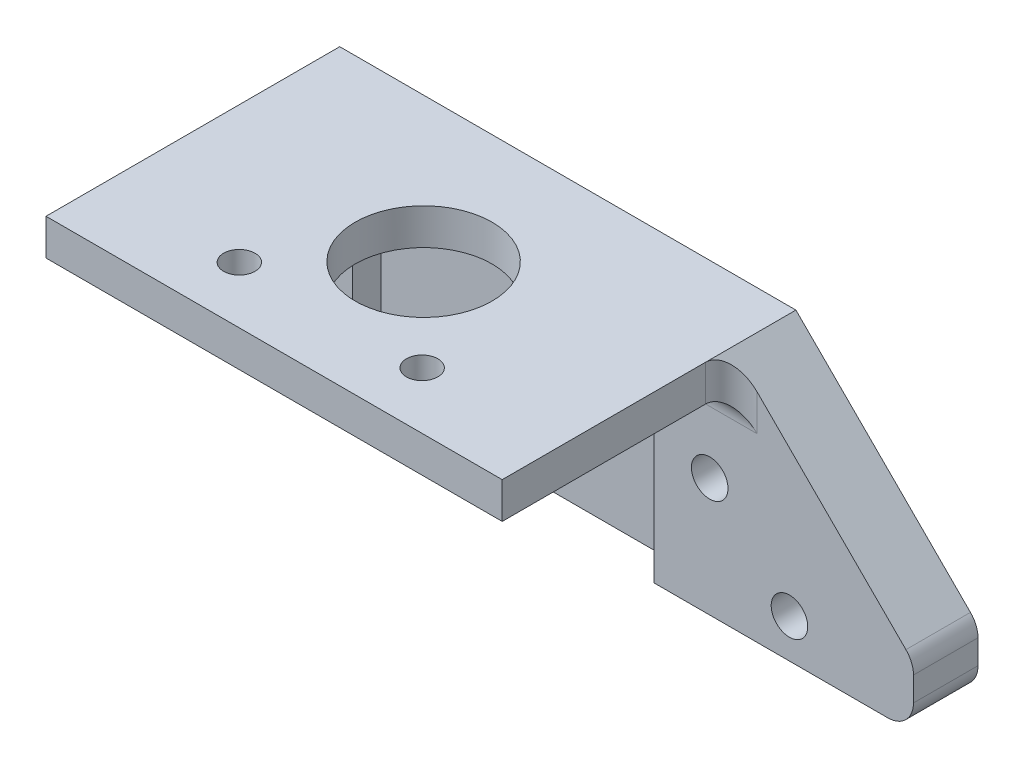
from build123d import *

# Parameters (mm, degrees)
BOSS_EXTRUDE1_DEPTH      = 1.7859375
BOSS_EXTRUDE1_DEPTH_BACK = 1.7859375
SKETCH2_W                = 45
SKETCH2_H                = 3.571875
BOSS_EXTRUDE2_DEPTH      = 25.4
FILLET1_R                = 2
SKETCH9_W                = 44.9012818
SKETCH9_H                = 1.417156311
CUT_EXTRUDE1_DEPTH       = 10
BOSS_EXTRUDE3_DEPTH      = 3.571875
SKETCH14_R               = 2.4384
CUT_EXTRUDE4_DEPTH       = 53.928506192
CUT_EXTRUDE5_DEPTH       = 57.499569383
CUT_EXTRUDE5_DEPTH_BACK  = 57.499569383
SKETCH15_R               = 6.75
SKETCH15_R_2             = 1.55
SKETCH19_R               = 1.8034
BOSS_EXTRUDE6_DEPTH      = 2.794
FILLET3_R                = 2.54


with BuildPart() as part:
    # Sketch1 → Boss-Extrude1 (new, two sides: drawn at the far end of the back side and taken through both)
    with BuildSketch(Plane.XY.offset(5).offset(-BOSS_EXTRUDE1_DEPTH_BACK)):
        with BuildLine():
            Line((-21.183407813, 0), (-21.183407813, -8.813455393))
            ThreePointArc((-21.183407813, -8.813455393), (-22.866221682, -12.686440931), (-19.530849883, -15.276262248))
            Line((-19.530849883, -15.276262248), (24.68248716, -15.276262248))
            ThreePointArc((24.68248716, -15.276262248), (25.214329472, -14.744419936), (24.68248716, -14.212577623))
            Line((24.68248716, -14.212577623), (23.717873987, 0))
            Line((23.717873987, 0), (23.717873987, 4.989031311))
            Line((23.717873987, 4.989031311), (-21.183407813, 4.989031311))
            Line((-21.183407813, 4.989031311), (-21.183407813, 0))
        make_face()
    extrude(amount=BOSS_EXTRUDE1_DEPTH + BOSS_EXTRUDE1_DEPTH_BACK)

    # Sketch2 → Boss-Extrude2 (add)
    with BuildSketch(Plane.XY.offset(6.7859375)):
        with Locations((1.270019176, 1.7859375)):
            Rectangle(SKETCH2_W, SKETCH2_H)
    extrude(amount=BOSS_EXTRUDE2_DEPTH)

    # Fillet1
    fillet1_edges = [part.edges().sort_by_distance(p)[0] for p in [
        (1.267233087, 4.989031311, 3.2140625),
    ]]
    fillet(fillet1_edges, radius=FILLET1_R)

    # Sketch9 → Cut-Extrude1 (cut)
    with BuildSketch(Plane.XY.offset(6.7859375)):
        with Locations((1.267233087, 4.280453156)):
            Rectangle(SKETCH9_W, SKETCH9_H)
    extrude(amount=-CUT_EXTRUDE1_DEPTH, mode=Mode.SUBTRACT)

    # Sketch13 → Boss-Extrude3 (add, through all)
    with BuildSketch(Plane.XY.offset(6.7859375)):
        Polygon((-21.229980824, 3.571875), (-39.190493066, -14.388637242), (-39.190493066, -20.367363974), (41.730531418, -20.367363974), (41.730531418, -14.388637242), (23.770019176, 3.571875), align=None)
    extrude(amount=-BOSS_EXTRUDE3_DEPTH)

    # Sketch14 → Cut-Extrude4 (cut, through all)
    with BuildSketch(Plane.XY.offset(6.7859375)):
        with Locations((-26.959384229, -16.525938199)):
            Circle(SKETCH14_R)
        with Locations((-19.092679867, -8.659233837)):
            Circle(SKETCH14_R)
        with Locations((21.632718219, -8.659233837)):
            Circle(SKETCH14_R)
        with Locations((29.499422581, -16.525938199)):
            Circle(SKETCH14_R)
    extrude(amount=-CUT_EXTRUDE4_DEPTH, mode=Mode.SUBTRACT)

    # Sketch15 → Cut-Extrude5 (cut, two sides: drawn at the far end of the back side and taken through both)
    with BuildSketch(Plane.XZ.offset(-CUT_EXTRUDE5_DEPTH_BACK)):
        with Locations(Location((1.270019176, 17.4380625, 0), (0, 0, 270))):
            Circle(SKETCH15_R)
        with Locations(Location((-7.763980824, 26.5820625, 0), (0, 0, 270))):
            Circle(SKETCH15_R_2)
        with Locations(Location((10.270019176, 26.5820625, 0), (0, 0, 270))):
            Circle(SKETCH15_R_2)
    extrude(amount=CUT_EXTRUDE5_DEPTH + CUT_EXTRUDE5_DEPTH_BACK, mode=Mode.SUBTRACT)

    # Sketch19 → Boss-Extrude6 (add)
    # profile 1 of 2: a face of its own
    with BuildSketch(Plane.XY.offset(6.7859375)):
        Polygon((-39.190493066, -14.388637242), (-21.229980824, 3.571875), (-21.229980824, 0), (-13.609980824, 0), (-13.609980824, -20.367363974), (-39.190493066, -20.367363974), align=None)
        with Locations((-19.092679867, -8.659233837)):
            Circle(SKETCH19_R, mode=Mode.SUBTRACT)
        with Locations((-26.959384229, -16.525938199)):
            Circle(SKETCH19_R, mode=Mode.SUBTRACT)
    # profile 2 of 2: a face of its own
    with BuildSketch(Plane.XY.offset(6.7859375)):
        Polygon((41.730531418, -20.367363974), (41.730531418, -14.388637242), (23.770019176, 3.571875), (23.770019176, 0), (16.150019176, 0), (16.150019176, -20.367363974), align=None)
        with Locations((21.632718219, -8.659233837)):
            Circle(SKETCH19_R, mode=Mode.SUBTRACT)
        with Locations((29.499422581, -16.525938199)):
            Circle(SKETCH19_R, mode=Mode.SUBTRACT)
    extrude(amount=BOSS_EXTRUDE6_DEPTH)

    # Fillet3
    # the kernel refuses this fillet: 2.54 mm, written as the material it adds along each edge
    with BuildSketch(Plane(origin=(16.150019176, 0, 6.7859375), x_dir=(0, -1, 0), z_dir=(-1, 0, 0))) as fillet3_piece_1:
        with BuildLine():
            CenterArc((FILLET3_R, FILLET3_R), FILLET3_R, 180, 90)
            Line((0, FILLET3_R), (-FILLET3_R * 0.02, FILLET3_R))
            Line((-FILLET3_R * 0.02, FILLET3_R), (-FILLET3_R * 0.02, -FILLET3_R * 0.02))
            Line((-FILLET3_R * 0.02, -FILLET3_R * 0.02), (FILLET3_R, -FILLET3_R * 0.02))
            Line((FILLET3_R, -FILLET3_R * 0.02), (FILLET3_R, 0))
        make_face()
    extrude(amount=29.76)
    with BuildSketch(Plane(origin=(-21.229980824, 0, 9.5799375), x_dir=(0, -1, 0), z_dir=(1, 0, 0))) as fillet3_piece_2:
        with BuildLine():
            CenterArc((FILLET3_R, -FILLET3_R), FILLET3_R, 90, 90)
            Line((0, -FILLET3_R), (-FILLET3_R * 0.02, -FILLET3_R))
            Line((-FILLET3_R * 0.02, -FILLET3_R), (-FILLET3_R * 0.02, FILLET3_R * 0.02))
            Line((-FILLET3_R * 0.02, FILLET3_R * 0.02), (FILLET3_R, FILLET3_R * 0.02))
            Line((FILLET3_R, FILLET3_R * 0.02), (FILLET3_R, 0))
        make_face()
    extrude(amount=7.62)
    with BuildSketch(Plane(origin=(-21.229980824, 3.571875, 9.5799375), x_dir=(-1, 0, 0), z_dir=(0, -1, 0))) as fillet3_piece_3_section:
        with BuildLine():
            CenterArc((FILLET3_R, -FILLET3_R), FILLET3_R, 90, 90)
            Line((0, -FILLET3_R), (-FILLET3_R * 0.02, -FILLET3_R))
            Line((-FILLET3_R * 0.02, -FILLET3_R), (-FILLET3_R * 0.02, FILLET3_R * 0.02))
            Line((-FILLET3_R * 0.02, FILLET3_R * 0.02), (FILLET3_R, FILLET3_R * 0.02))
            Line((FILLET3_R, FILLET3_R * 0.02), (FILLET3_R, 0))
        make_face()
    fillet3_piece_3 = extrude(amount=3.571875, mode=Mode.PRIVATE)
    fillet3_piece_3 = split(fillet3_piece_3, bisect_by=Plane(origin=(-22.480055671, 2.321800154, 10.2136759), z_dir=(0.7071067811865489, -0.7071067811865461, 0)), keep=Keep.TOP, mode=Mode.PRIVATE)
    add(fillet3_piece_3)
    with BuildSketch(Plane(origin=(-13.609980824, 0, 6.7859375), x_dir=(0, -1, 0), z_dir=(0, 0, 1))) as fillet3_piece_4:
        with BuildLine():
            CenterArc((FILLET3_R, FILLET3_R), FILLET3_R, 180, 90)
            Line((0, FILLET3_R), (-FILLET3_R * 0.02, FILLET3_R))
            Line((-FILLET3_R * 0.02, FILLET3_R), (-FILLET3_R * 0.02, -FILLET3_R * 0.02))
            Line((-FILLET3_R * 0.02, -FILLET3_R * 0.02), (FILLET3_R, -FILLET3_R * 0.02))
            Line((FILLET3_R, -FILLET3_R * 0.02), (FILLET3_R, 0))
        make_face()
    extrude(amount=2.794)
    with BuildSketch(Plane(origin=(23.770019176, 3.571875, 9.5799375), x_dir=(1, 0, 0), z_dir=(0, -1, 0))) as fillet3_piece_5_section:
        with BuildLine():
            CenterArc((FILLET3_R, FILLET3_R), FILLET3_R, 180, 90)
            Line((0, FILLET3_R), (-FILLET3_R * 0.02, FILLET3_R))
            Line((-FILLET3_R * 0.02, FILLET3_R), (-FILLET3_R * 0.02, -FILLET3_R * 0.02))
            Line((-FILLET3_R * 0.02, -FILLET3_R * 0.02), (FILLET3_R, -FILLET3_R * 0.02))
            Line((FILLET3_R, -FILLET3_R * 0.02), (FILLET3_R, 0))
        make_face()
    fillet3_piece_5 = extrude(amount=3.571875, mode=Mode.PRIVATE)
    fillet3_piece_5 = split(fillet3_piece_5, bisect_by=Plane(origin=(25.020094022, 2.321800154, 10.2136759), z_dir=(-0.7071067811865436, -0.7071067811865516, 0)), keep=Keep.TOP, mode=Mode.PRIVATE)
    add(fillet3_piece_5)
    with BuildSketch(Plane(origin=(23.770019176, 0, 9.5799375), x_dir=(0, -1, 0), z_dir=(-1, 0, 0))) as fillet3_piece_6:
        with BuildLine():
            CenterArc((FILLET3_R, FILLET3_R), FILLET3_R, 180, 90)
            Line((0, FILLET3_R), (-FILLET3_R * 0.02, FILLET3_R))
            Line((-FILLET3_R * 0.02, FILLET3_R), (-FILLET3_R * 0.02, -FILLET3_R * 0.02))
            Line((-FILLET3_R * 0.02, -FILLET3_R * 0.02), (FILLET3_R, -FILLET3_R * 0.02))
            Line((FILLET3_R, -FILLET3_R * 0.02), (FILLET3_R, 0))
        make_face()
    extrude(amount=7.62)
    with BuildSketch(Plane(origin=(16.150019176, 0, 6.7859375), x_dir=(0, -1, 0), z_dir=(0, 0, 1))) as fillet3_piece_7:
        with BuildLine():
            CenterArc((FILLET3_R, -FILLET3_R), FILLET3_R, 90, 90)
            Line((0, -FILLET3_R), (-FILLET3_R * 0.02, -FILLET3_R))
            Line((-FILLET3_R * 0.02, -FILLET3_R), (-FILLET3_R * 0.02, FILLET3_R * 0.02))
            Line((-FILLET3_R * 0.02, FILLET3_R * 0.02), (FILLET3_R, FILLET3_R * 0.02))
            Line((FILLET3_R, FILLET3_R * 0.02), (FILLET3_R, 0))
        make_face()
    extrude(amount=2.794)
    with BuildSketch(Plane(origin=(16.150019176, 0, 0.4359375), x_dir=(0, -1, 0), z_dir=(0, 0, 1))) as fillet3_piece_8a_section:
        with BuildLine():
            CenterArc((FILLET3_R, -FILLET3_R), FILLET3_R, 90, 90)
            Line((0, -FILLET3_R), (-FILLET3_R * 0.02, -FILLET3_R))
            Line((-FILLET3_R * 0.02, -FILLET3_R), (-FILLET3_R * 0.02, FILLET3_R * 0.02))
            Line((-FILLET3_R * 0.02, FILLET3_R * 0.02), (FILLET3_R, FILLET3_R * 0.02))
            Line((FILLET3_R, FILLET3_R * 0.02), (FILLET3_R, 0))
        make_face()
    fillet3_piece_8a = extrude(amount=9.144, mode=Mode.PRIVATE)
    fillet3_piece_8a = split(fillet3_piece_8a, bisect_by=Plane(origin=(15.574975586, -0.57504359, 6.7859375), z_dir=(0, 0, -1)), keep=Keep.TOP, mode=Mode.PRIVATE)
    with BuildSketch(Plane(origin=(22.500019176, 0, 6.7859375), x_dir=(0, -1, 0), z_dir=(-1, 0, 0))) as fillet3_piece_8b_section:
        with BuildLine():
            CenterArc((FILLET3_R, FILLET3_R), FILLET3_R, 180, 90)
            Line((0, FILLET3_R), (-FILLET3_R * 0.02, FILLET3_R))
            Line((-FILLET3_R * 0.02, FILLET3_R), (-FILLET3_R * 0.02, -FILLET3_R * 0.02))
            Line((-FILLET3_R * 0.02, -FILLET3_R * 0.02), (FILLET3_R, -FILLET3_R * 0.02))
            Line((FILLET3_R, -FILLET3_R * 0.02), (FILLET3_R, 0))
        make_face()
    fillet3_piece_8b = extrude(amount=36.11, mode=Mode.PRIVATE)
    fillet3_piece_8b = split(fillet3_piece_8b, bisect_by=Plane(origin=(16.150019176, -0.57504359, 7.36098109), z_dir=(1, 0, 0)), keep=Keep.TOP, mode=Mode.PRIVATE)
    fillet3_piece_8 = fillet3_piece_8a & fillet3_piece_8b
    add(fillet3_piece_8)
    with BuildSketch(Plane(origin=(16.150019176, 0, 6.7859375), x_dir=(0, -1, 0), z_dir=(-1, 0, 0))) as fillet3_piece_9a_section:
        with BuildLine():
            CenterArc((FILLET3_R, FILLET3_R), FILLET3_R, 180, 90)
            Line((0, FILLET3_R), (-FILLET3_R * 0.02, FILLET3_R))
            Line((-FILLET3_R * 0.02, FILLET3_R), (-FILLET3_R * 0.02, -FILLET3_R * 0.02))
            Line((-FILLET3_R * 0.02, -FILLET3_R * 0.02), (FILLET3_R, -FILLET3_R * 0.02))
            Line((FILLET3_R, -FILLET3_R * 0.02), (FILLET3_R, 0))
        make_face()
    fillet3_piece_9a = extrude(amount=36.11, mode=Mode.PRIVATE)
    fillet3_piece_9a = split(fillet3_piece_9a, bisect_by=Plane(origin=(-13.609980824, -0.57504359, 7.36098109), z_dir=(-1, 0, 0)), keep=Keep.TOP, mode=Mode.PRIVATE)
    with BuildSketch(Plane(origin=(-13.609980824, 0, 0.4359375), x_dir=(0, -1, 0), z_dir=(0, 0, 1))) as fillet3_piece_9b_section:
        with BuildLine():
            CenterArc((FILLET3_R, FILLET3_R), FILLET3_R, 180, 90)
            Line((0, FILLET3_R), (-FILLET3_R * 0.02, FILLET3_R))
            Line((-FILLET3_R * 0.02, FILLET3_R), (-FILLET3_R * 0.02, -FILLET3_R * 0.02))
            Line((-FILLET3_R * 0.02, -FILLET3_R * 0.02), (FILLET3_R, -FILLET3_R * 0.02))
            Line((FILLET3_R, -FILLET3_R * 0.02), (FILLET3_R, 0))
        make_face()
    fillet3_piece_9b = extrude(amount=9.144, mode=Mode.PRIVATE)
    fillet3_piece_9b = split(fillet3_piece_9b, bisect_by=Plane(origin=(-13.034937234, -0.57504359, 6.7859375), z_dir=(0, 0, -1)), keep=Keep.TOP, mode=Mode.PRIVATE)
    fillet3_piece_9 = fillet3_piece_9a & fillet3_piece_9b
    add(fillet3_piece_9)
    with BuildSketch(Plane(origin=(-21.229980824, 3.571875, 9.5799375), x_dir=(-1, 0, 0), z_dir=(0, -1, 0))) as fillet3_piece_10a_section:
        with BuildLine():
            CenterArc((FILLET3_R, -FILLET3_R), FILLET3_R, 90, 90)
            Line((0, -FILLET3_R), (-FILLET3_R * 0.02, -FILLET3_R))
            Line((-FILLET3_R * 0.02, -FILLET3_R), (-FILLET3_R * 0.02, FILLET3_R * 0.02))
            Line((-FILLET3_R * 0.02, FILLET3_R * 0.02), (FILLET3_R, FILLET3_R * 0.02))
            Line((FILLET3_R, FILLET3_R * 0.02), (FILLET3_R, 0))
        make_face()
    fillet3_piece_10a = extrude(amount=9.921875, mode=Mode.PRIVATE)
    fillet3_piece_10a = split(fillet3_piece_10a, bisect_by=Plane(origin=(-21.805024414, 0, 10.15498109), z_dir=(0, -1, 0)), keep=Keep.TOP, mode=Mode.PRIVATE)
    with BuildSketch(Plane(origin=(-27.579980824, 0, 9.5799375), x_dir=(0, -1, 0), z_dir=(1, 0, 0))) as fillet3_piece_10b_section:
        with BuildLine():
            CenterArc((FILLET3_R, -FILLET3_R), FILLET3_R, 90, 90)
            Line((0, -FILLET3_R), (-FILLET3_R * 0.02, -FILLET3_R))
            Line((-FILLET3_R * 0.02, -FILLET3_R), (-FILLET3_R * 0.02, FILLET3_R * 0.02))
            Line((-FILLET3_R * 0.02, FILLET3_R * 0.02), (FILLET3_R, FILLET3_R * 0.02))
            Line((FILLET3_R, FILLET3_R * 0.02), (FILLET3_R, 0))
        make_face()
    fillet3_piece_10b = extrude(amount=13.97, mode=Mode.PRIVATE)
    fillet3_piece_10b = split(fillet3_piece_10b, bisect_by=Plane(origin=(-21.229980824, -0.57504359, 10.15498109), z_dir=(-1, 0, 0)), keep=Keep.TOP, mode=Mode.PRIVATE)
    fillet3_piece_10 = fillet3_piece_10a & fillet3_piece_10b
    add(fillet3_piece_10)
    with BuildSketch(Plane(origin=(-13.609980824, 0, 6.7859375), x_dir=(0, -1, 0), z_dir=(0, 0, 1))) as fillet3_piece_11a_section:
        with BuildLine():
            CenterArc((FILLET3_R, FILLET3_R), FILLET3_R, 180, 90)
            Line((0, FILLET3_R), (-FILLET3_R * 0.02, FILLET3_R))
            Line((-FILLET3_R * 0.02, FILLET3_R), (-FILLET3_R * 0.02, -FILLET3_R * 0.02))
            Line((-FILLET3_R * 0.02, -FILLET3_R * 0.02), (FILLET3_R, -FILLET3_R * 0.02))
            Line((FILLET3_R, -FILLET3_R * 0.02), (FILLET3_R, 0))
        make_face()
    fillet3_piece_11a = extrude(amount=9.144, mode=Mode.PRIVATE)
    fillet3_piece_11a = split(fillet3_piece_11a, bisect_by=Plane(origin=(-13.034937234, -0.57504359, 9.5799375), z_dir=(0, 0, 1)), keep=Keep.TOP, mode=Mode.PRIVATE)
    with BuildSketch(Plane(origin=(-21.229980824, 0, 9.5799375), x_dir=(0, -1, 0), z_dir=(1, 0, 0))) as fillet3_piece_11b_section:
        with BuildLine():
            CenterArc((FILLET3_R, -FILLET3_R), FILLET3_R, 90, 90)
            Line((0, -FILLET3_R), (-FILLET3_R * 0.02, -FILLET3_R))
            Line((-FILLET3_R * 0.02, -FILLET3_R), (-FILLET3_R * 0.02, FILLET3_R * 0.02))
            Line((-FILLET3_R * 0.02, FILLET3_R * 0.02), (FILLET3_R, FILLET3_R * 0.02))
            Line((FILLET3_R, FILLET3_R * 0.02), (FILLET3_R, 0))
        make_face()
    fillet3_piece_11b = extrude(amount=13.97, mode=Mode.PRIVATE)
    fillet3_piece_11b = split(fillet3_piece_11b, bisect_by=Plane(origin=(-13.609980824, -0.57504359, 10.15498109), z_dir=(1, 0, 0)), keep=Keep.TOP, mode=Mode.PRIVATE)
    fillet3_piece_11 = fillet3_piece_11a & fillet3_piece_11b
    add(fillet3_piece_11)
    with BuildSketch(Plane(origin=(23.770019176, 3.571875, 9.5799375), x_dir=(1, 0, 0), z_dir=(0, -1, 0))) as fillet3_piece_12a_section:
        with BuildLine():
            CenterArc((FILLET3_R, FILLET3_R), FILLET3_R, 180, 90)
            Line((0, FILLET3_R), (-FILLET3_R * 0.02, FILLET3_R))
            Line((-FILLET3_R * 0.02, FILLET3_R), (-FILLET3_R * 0.02, -FILLET3_R * 0.02))
            Line((-FILLET3_R * 0.02, -FILLET3_R * 0.02), (FILLET3_R, -FILLET3_R * 0.02))
            Line((FILLET3_R, -FILLET3_R * 0.02), (FILLET3_R, 0))
        make_face()
    fillet3_piece_12a = extrude(amount=9.921875, mode=Mode.PRIVATE)
    fillet3_piece_12a = split(fillet3_piece_12a, bisect_by=Plane(origin=(24.345062766, 0, 10.15498109), z_dir=(0, -1, 0)), keep=Keep.TOP, mode=Mode.PRIVATE)
    with BuildSketch(Plane(origin=(30.120019176, 0, 9.5799375), x_dir=(0, -1, 0), z_dir=(-1, 0, 0))) as fillet3_piece_12b_section:
        with BuildLine():
            CenterArc((FILLET3_R, FILLET3_R), FILLET3_R, 180, 90)
            Line((0, FILLET3_R), (-FILLET3_R * 0.02, FILLET3_R))
            Line((-FILLET3_R * 0.02, FILLET3_R), (-FILLET3_R * 0.02, -FILLET3_R * 0.02))
            Line((-FILLET3_R * 0.02, -FILLET3_R * 0.02), (FILLET3_R, -FILLET3_R * 0.02))
            Line((FILLET3_R, -FILLET3_R * 0.02), (FILLET3_R, 0))
        make_face()
    fillet3_piece_12b = extrude(amount=13.97, mode=Mode.PRIVATE)
    fillet3_piece_12b = split(fillet3_piece_12b, bisect_by=Plane(origin=(23.770019176, -0.57504359, 10.15498109), z_dir=(1, 0, 0)), keep=Keep.TOP, mode=Mode.PRIVATE)
    fillet3_piece_12 = fillet3_piece_12a & fillet3_piece_12b
    add(fillet3_piece_12)
    with BuildSketch(Plane(origin=(23.770019176, 0, 9.5799375), x_dir=(0, -1, 0), z_dir=(-1, 0, 0))) as fillet3_piece_13a_section:
        with BuildLine():
            CenterArc((FILLET3_R, FILLET3_R), FILLET3_R, 180, 90)
            Line((0, FILLET3_R), (-FILLET3_R * 0.02, FILLET3_R))
            Line((-FILLET3_R * 0.02, FILLET3_R), (-FILLET3_R * 0.02, -FILLET3_R * 0.02))
            Line((-FILLET3_R * 0.02, -FILLET3_R * 0.02), (FILLET3_R, -FILLET3_R * 0.02))
            Line((FILLET3_R, -FILLET3_R * 0.02), (FILLET3_R, 0))
        make_face()
    fillet3_piece_13a = extrude(amount=13.97, mode=Mode.PRIVATE)
    fillet3_piece_13a = split(fillet3_piece_13a, bisect_by=Plane(origin=(16.150019176, -0.57504359, 10.15498109), z_dir=(-1, 0, 0)), keep=Keep.TOP, mode=Mode.PRIVATE)
    with BuildSketch(Plane(origin=(16.150019176, 0, 6.7859375), x_dir=(0, -1, 0), z_dir=(0, 0, 1))) as fillet3_piece_13b_section:
        with BuildLine():
            CenterArc((FILLET3_R, -FILLET3_R), FILLET3_R, 90, 90)
            Line((0, -FILLET3_R), (-FILLET3_R * 0.02, -FILLET3_R))
            Line((-FILLET3_R * 0.02, -FILLET3_R), (-FILLET3_R * 0.02, FILLET3_R * 0.02))
            Line((-FILLET3_R * 0.02, FILLET3_R * 0.02), (FILLET3_R, FILLET3_R * 0.02))
            Line((FILLET3_R, FILLET3_R * 0.02), (FILLET3_R, 0))
        make_face()
    fillet3_piece_13b = extrude(amount=9.144, mode=Mode.PRIVATE)
    fillet3_piece_13b = split(fillet3_piece_13b, bisect_by=Plane(origin=(15.574975586, -0.57504359, 9.5799375), z_dir=(0, 0, 1)), keep=Keep.TOP, mode=Mode.PRIVATE)
    fillet3_piece_13 = fillet3_piece_13a & fillet3_piece_13b
    add(fillet3_piece_13)
    # the kernel refuses this fillet: 2.54 mm, written as the material it takes off along each edge
    with BuildSketch(Plane(origin=(41.730531418, -20.367363974, 3.2140625), x_dir=(0, 1, 0), z_dir=(0, 0, 1)), Plane(origin=(-39.190493066, -20.367363974, 3.2140625), x_dir=(1, 0, 0), z_dir=(0, 0, 1))) as fillet3_2_piece_1:
        with BuildLine():
            CenterArc((FILLET3_R, FILLET3_R), FILLET3_R, 180, 90)
            Line((0, FILLET3_R), (-FILLET3_R * 0.02, FILLET3_R))
            Line((-FILLET3_R * 0.02, FILLET3_R), (-FILLET3_R * 0.02, -FILLET3_R * 0.02))
            Line((-FILLET3_R * 0.02, -FILLET3_R * 0.02), (FILLET3_R, -FILLET3_R * 0.02))
            Line((FILLET3_R, -FILLET3_R * 0.02), (FILLET3_R, 0))
        make_face()
    extrude(amount=6.365875, mode=Mode.SUBTRACT)
    with BuildSketch(Plane(origin=(-39.190493066, -14.388637242, 3.2140625), x_dir=(0, -1, 0), z_dir=(0, 0, 1)), Plane(origin=(41.730531418, -14.388637242, 9.5799375), x_dir=(0, -1, 0), z_dir=(0, 0, -1))) as fillet3_2_piece_2:
        with BuildLine():
            CenterArc((FILLET3_R * 0.414213562373, FILLET3_R), FILLET3_R, 225, 45)
            Line((-FILLET3_R * 0.292893218813, FILLET3_R * 0.292893218813), (-FILLET3_R * 0.307035354437, FILLET3_R * 0.27875108319))
            Line((-FILLET3_R * 0.307035354437, FILLET3_R * 0.27875108319), (-FILLET3_R * 0.00828427124746, -FILLET3_R * 0.02))
            Line((-FILLET3_R * 0.00828427124746, -FILLET3_R * 0.02), (FILLET3_R * 0.414213562373, -FILLET3_R * 0.02))
            Line((FILLET3_R * 0.414213562373, -FILLET3_R * 0.02), (FILLET3_R * 0.414213562373, 0))
        make_face()
    extrude(amount=6.365875, mode=Mode.SUBTRACT)


solid = part.part
